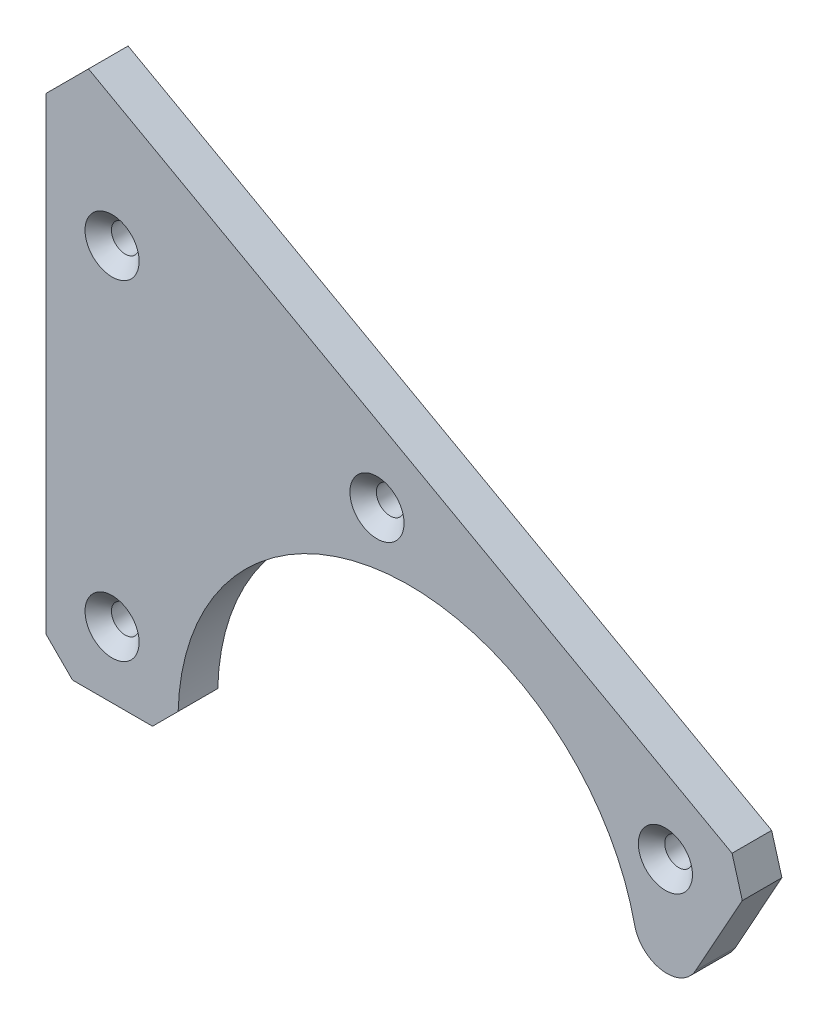
from build123d import *

# Parameters (mm, degrees)
SKETCH_1_R          = 2.1
SKETCH_1_R_2        = 4
SKETCH_1_R_3        = 11
EXTRUDE_1_DEPTH     = 3
SKETCH_3_R          = 2.1
CUT_EXTRUDE_1_DEPTH = 99.947101842
CHAMFER_2_SIZE      = 4
CHAMFER_3_SIZE      = 10
CHAMFER_3_SIZE2     = 7.354021529
SKETCH_4_W          = 7.6
SKETCH_4_H          = 9.2
CUT_EXTRUDE_2_DEPTH = 97.00692173
FILLET_1_R          = 2
SKETCH_5_R          = 2.1
CUT_EXTRUDE_3_DEPTH = 97.00692173
CHAMFER_1_SIZE      = 2
SKETCH_6_R          = 35
CUT_EXTRUDE_4_DEPTH = 97.00692173
FILLET_START        = -3
FILLET_2_DEPTH      = 6
CHAMFER_4_SIZE      = 4


with BuildPart() as part:
    # 草图1 → 凸台-拉伸1 (new, symmetric)
    with BuildSketch(Plane.XY):
        with BuildLine():
            Line((-55, 82.03370626), (-55, -2.96629374))
            Line((-55, -2.96629374), (-34.874074919, -2.96629374))
            ThreePointArc((-34.874074919, -2.96629374), (-7.334524273, -34.22286887), (30.595504664, -16.997502591))
            Line((30.595504664, -16.997502591), (52.449436567, 22.339574834))
            Line((52.449436567, 22.339574834), (-55, 82.03370626))
        make_face()
        with Locations((29, 0)):
            Circle(SKETCH_1_R, mode=Mode.SUBTRACT)
        with Locations((-14.5, -25.11473671)):
            Circle(SKETCH_1_R, mode=Mode.SUBTRACT)
        with Locations((-14.5, 25.11473671)):
            Circle(SKETCH_1_R, mode=Mode.SUBTRACT)
        with Locations((-9.625, 16.670989023)):
            Circle(SKETCH_1_R_2, mode=Mode.SUBTRACT)
        Circle(SKETCH_1_R_3, mode=Mode.SUBTRACT)
    extrude(amount=EXTRUDE_1_DEPTH, both=True)

    # 草图3 → 切除-拉伸1 (cut, through all)
    with BuildSketch(Plane.XY.offset(3)):
        with Locations((-45, 7.03370626)):
            Circle(SKETCH_3_R)
        with Locations((-45, 57.03370626)):
            Circle(SKETCH_3_R)
    extrude(amount=-CUT_EXTRUDE_1_DEPTH, mode=Mode.SUBTRACT)

    # 倒角2
    chamfer_2_edges = [part.edges().sort_by_distance(p)[0] for p in [
        (52.449436567, 22.339574834, 0),
        (-55, -2.96629374, 0),
    ]]
    chamfer(chamfer_2_edges, length=CHAMFER_2_SIZE)

    # 倒角3
    chamfer_3_edges = [part.edges().sort_by_distance(p)[0] for p in [
        (-55, 82.03370626, 0),
    ]]
    chamfer_3_side = [part.faces().sort_by_distance(p)[0] for p in [
        (-55, 41.53370626, 0),
    ]]
    chamfer(chamfer_3_edges, length=CHAMFER_3_SIZE, length2=CHAMFER_3_SIZE2, reference=chamfer_3_side[0])

    # 草图4 → 切除-拉伸2 (cut, through all)
    with BuildSketch(Plane.XY.offset(3)):
        with Locations((-18.5, 0)):
            Rectangle(SKETCH_4_W, SKETCH_4_H)
    extrude(amount=-CUT_EXTRUDE_2_DEPTH, mode=Mode.SUBTRACT)

    # 圆角1
    fillet_1_edges = [part.edges().sort_by_distance(p)[0] for p in [
        (-14.7, 4.6, 0),
        (-14.7, -4.6, 0),
        (-22.3, -4.6, 0),
        (-22.3, 4.6, 0),
    ]]
    fillet(fillet_1_edges, radius=FILLET_1_R)

    # 草图5 → 切除-拉伸3 (cut, through all)
    with BuildSketch(Plane.XY.offset(3)):
        with Locations((-4.856429312, 42.736577944)):
            Circle(SKETCH_5_R)
        with Locations((38.851434494, 18.454431385)):
            Circle(SKETCH_5_R)
    extrude(amount=-CUT_EXTRUDE_3_DEPTH, mode=Mode.SUBTRACT)

    # 倒角1
    chamfer_1_edges = [part.edges().sort_by_distance(p)[0] for p in [
        (-6.956429312, 42.736577944, 3),
        (36.751434494, 18.454431385, 3),
        (26.9, 0, 3),
        (-47.1, 7.03370626, 3),
        (-47.1, 57.03370626, 3),
    ]]
    chamfer(chamfer_1_edges, length=CHAMFER_1_SIZE)

    # 草图6 → 切除-拉伸4 (cut, through all)
    with BuildSketch(Plane.XY.offset(3)):
        Circle(SKETCH_6_R)
    extrude(amount=-CUT_EXTRUDE_4_DEPTH, mode=Mode.SUBTRACT)

    # 圆角2: read off the stored shape, not the designer's step
    # 圆角2 outline → 圆角2 (cut)
    with BuildSketch(Plane.XY.offset(FILLET_START)):
        with BuildLine():
            ThreePointArc((43.444408883, 6.130525003), (38.347542021, 3.611739847), (34.18941969, 7.488897201))
            ThreePointArc((34.18941969, 7.488897201), (34.62899868, -5.082563371), (30.595504664, -16.997502591))
            Line((30.595504664, -16.997502591), (43.444408883, 6.130525003))
        make_face()
    extrude(amount=FILLET_2_DEPTH, mode=Mode.SUBTRACT)

    # 倒角4
    # the kernel refuses this chamfer: 4, 3.699752538 mm, written as the material it takes off along each edge
    with BuildSketch(Plane(origin=(-34.874074919, -2.96629374, 13.286731952), x_dir=(-0.029279801283292956, 0.9995712547071425, 0), z_dir=(0, 0, -1))) as chamfer_4_piece_1:
        with BuildLine():
            Line((3.887831943, 0), (CHAMFER_4_SIZE * 0.0292798012833, -CHAMFER_4_SIZE * 0.999571254707))
            Line((CHAMFER_4_SIZE * 0.0292798012833, -CHAMFER_4_SIZE * 0.999571254707), (0, 0))
            ThreePointArc((0, 0), (1.998980438, -0.05398137), (3.887831943, 0))
        make_face()
    extrude(amount=26.573463904, mode=Mode.SUBTRACT)


solid = part.part
